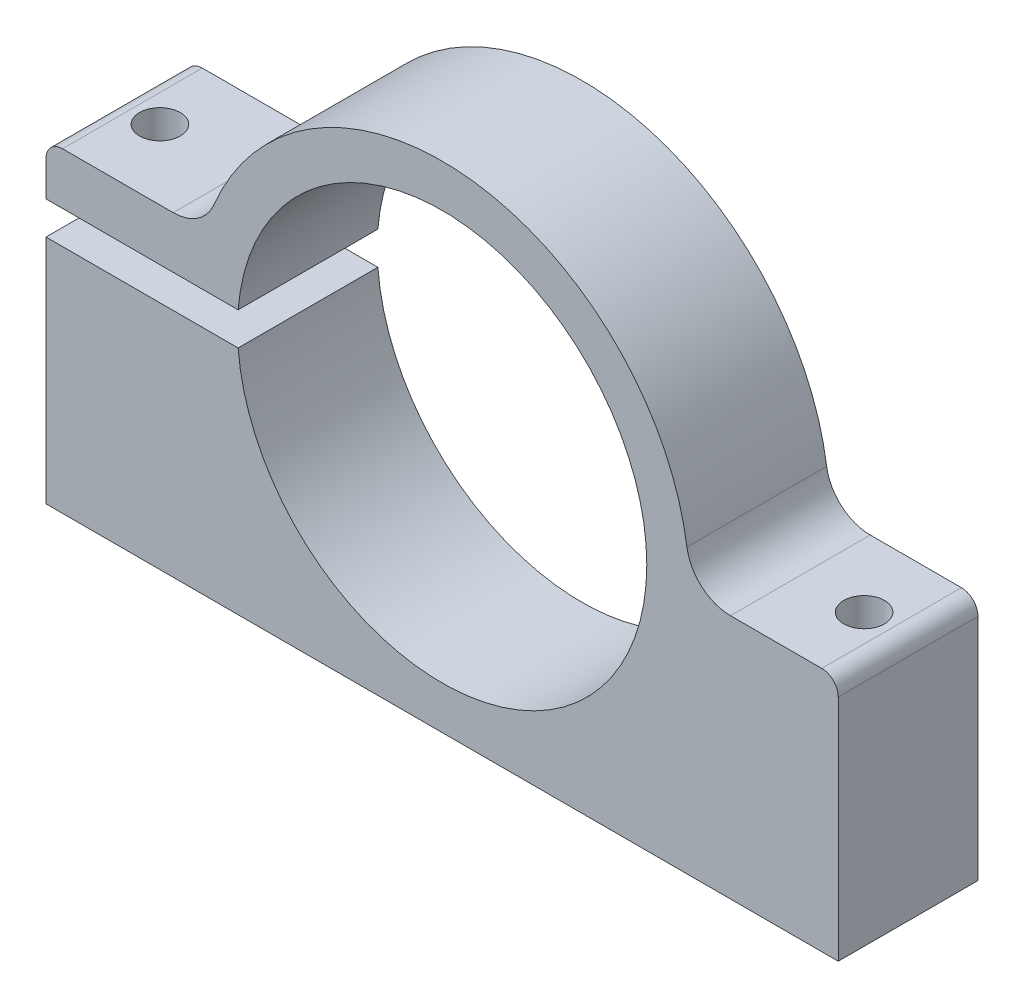
from build123d import *

# Parameters (mm, degrees)
BOSS_EXTRUDE1_DEPTH = 6.35
SKETCH2_R           = 18.6
CUT_EXTRUDE1_DEPTH  = 45.311849431
SKETCH5_R           = 1.85
CUT_EXTRUDE3_DEPTH  = 47.475934633
SKETCH6_R           = 1.85
CUT_EXTRUDE4_DEPTH  = 44.019819851
FILLET2_R           = 4
FILLET6_R           = 1.5


with BuildPart() as part:
    # Sketch1 → Boss-Extrude1 (new, symmetric)
    with BuildSketch(Plane.XY):
        with BuildLine():
            Line((0, -1.5), (-36, -1.5))
            Line((-36, -1.5), (-36, -22.5))
            Line((-36, -22.5), (36, -22.5))
            Line((36, -22.5), (36, -0.2))
            Line((36, -0.2), (22.479110303, -0.2))
            ThreePointArc((22.479110303, -0.2), (3.2294985, 22.246814141), (-21.608109589, 6.2))
            Line((-21.608109589, 6.2), (-36, 6.2))
            Line((-36, 6.2), (-36, 1.5))
            Line((-36, 1.5), (0, 1.5))
            Line((0, 1.5), (0, -1.5))
        make_face()
    extrude(amount=BOSS_EXTRUDE1_DEPTH, both=True)

    # Sketch2 → Cut-Extrude1 (cut, through all)
    with BuildSketch(Plane.XY.offset(6.35)):
        Circle(SKETCH2_R)
    extrude(amount=-CUT_EXTRUDE1_DEPTH, mode=Mode.SUBTRACT)

    # Sketch5 → Cut-Extrude3 (cut, through all)
    with BuildSketch(Plane(origin=(0, 6.2, 0), x_dir=(1, 0, 0), z_dir=(0, 1, 0))):
        with Locations((-32, 0)):
            Circle(SKETCH5_R)
    extrude(amount=-CUT_EXTRUDE3_DEPTH, mode=Mode.SUBTRACT)

    # Sketch6 → Cut-Extrude4 (cut, through all)
    with BuildSketch(Plane(origin=(0, -0.2, 0), x_dir=(1, 0, 0), z_dir=(0, 1, 0))):
        with Locations((32, 0)):
            Circle(SKETCH6_R)
    extrude(amount=-CUT_EXTRUDE4_DEPTH, mode=Mode.SUBTRACT)

    # Fillet2
    fillet2_edges = [part.edges().sort_by_distance(p)[0] for p in [
        (22.479110303, -0.2, 0),
        (-21.608109589, 6.2, 0),
    ]]
    fillet(fillet2_edges, radius=FILLET2_R)

    # Fillet6
    fillet6_edges = [part.edges().sort_by_distance(p)[0] for p in [
        (36, -0.2, 0),
        (-36, 6.2, 0),
    ]]
    fillet(fillet6_edges, radius=FILLET6_R)


solid = part.part
